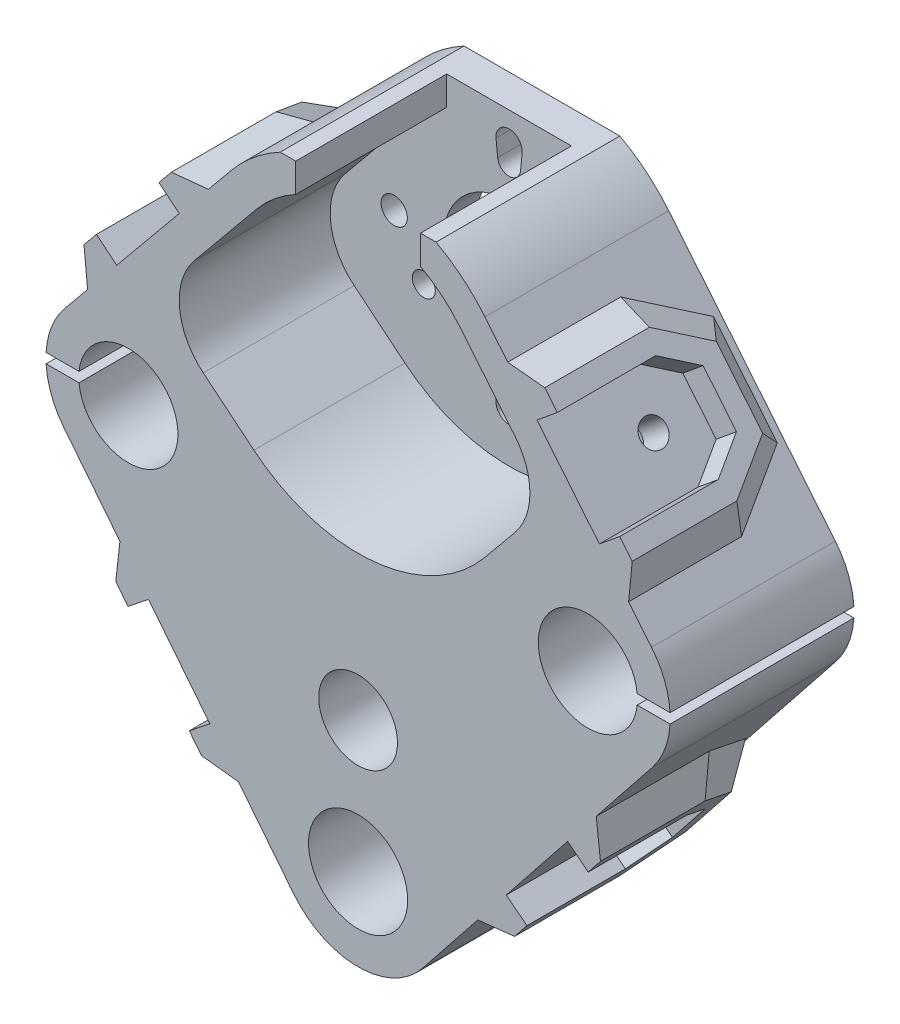
from build123d import *

# Parameters (mm, degrees)
SZKIC1_R                    = 7.550000000001571
SZKIC1_R_2                  = 6.000000000000003
DODANIE_WYCI_GNI_CIE1_DEPTH = 28
WYTNIJ_WYCI_GNI_CIE1_START  = -23
WYTNIJ_WYCI_GNI_CIE1_DEPTH  = 23
SZKIC3_R                    = 10.000000000000002
SZKIC3_R_2                  = 1.7500000000000033
SZKIC3_R_3                  = 1.7500000000000069
SZKIC3_R_4                  = 1.750000000000002
WYTNIJ_WYCI_GNI_CIE2_DEPTH  = 23
DODANIE_WYCI_GNI_CIE2_DEPTH = 23
ZAOKR_GLENIE2_R             = 10
WYTNIJ_WYCI_GNI_CIE3_START  = -10
SZKIC5_R                    = 2.000000000000005
SZKIC5_R_2                  = 2.0000000000000036
SZKIC5_R_3                  = 2.000000000000003
SZKIC5_R_4                  = 1.9999999999999971
SZKIC5_R_5                  = 1.7500000000000033
WYTNIJ_WYCI_GNI_CIE3_DEPTH  = 10
DODANIE_WYCI_GNI_CIE3_DEPTH = 4
SFAZOWANIE1_SIZE            = 4
DODANIE_WYCI_GNI_CIE4_DEPTH = 4
SFAZOWANIE2_SIZE            = 4
SZKIC8_R                    = 2.0000000000000018
WYTNIJ_WYCI_GNI_CIE4_DEPTH  = 5
SZKIC9_R                    = 1.9999999999999996
WYTNIJ_WYCI_GNI_CIE5_DEPTH  = 5
SFAZOWANIE3_SIZE            = 4


with BuildPart() as part:
    # Szkic1 → Dodanie-wyciągnięcie1 (new body)
    with BuildSketch(Plane.XY):
        with BuildLine():
            Line((-19.31958004687979, 62.866752245251845), (-44.69842918353365, 31.96510962711642))
            ThreePointArc((-44.69842918353365, 31.96510962711642), (-46.68388664689503, 28.581407297164034), (-47.527569596693525, 24.749999999999982))
            Line((-47.52756959669351, 24.74999999999998), (-42.512655988397164, 24.74999999999998))
            ThreePointArc((-42.51265598839718, 24.74999999999998), (-27.44999999999999, 24.000000000000014), (-42.51265598839717, 23.249999999999975))
            Line((-42.512655988397164, 23.24999999999998), (-47.52756959669352, 23.249999999999982))
            ThreePointArc((-47.52756959669352, 23.249999999999982), (-46.71930706256188, 19.509973054269363), (-44.82164322990438, 16.187329248939687))
            Line((-44.82164322990438, 16.18732924893969), (-9.82164322990438, -27.81267075106031))
            ThreePointArc((-9.82164322990438, -27.81267075106031), (8.21e-15, -32.55), (9.821643229904398, -27.81267075106031))
            Line((9.821643229904394, -27.812670751060306), (44.82164322990439, 16.187329248939694))
            ThreePointArc((44.82164322990438, 16.18732924893969), (46.71930706256188, 19.509973054269366), (47.52756959669352, 23.249999999999986))
            Line((47.52756959669352, 23.249999999999993), (42.512655988397164, 23.24999999999999))
            ThreePointArc((42.51265598839717, 23.249999999999986), (27.44999999999999, 24.00000000000001), (42.51265598839718, 24.74999999999999))
            Line((42.512655988397164, 24.74999999999999), (47.52756959669351, 24.74999999999999))
            ThreePointArc((47.52756959669352, 24.74999999999999), (46.68388664689503, 28.581407297164038), (44.69842918353365, 31.965109627116423))
            Line((44.698429183533655, 31.965109627116426), (19.319580046879793, 62.866752245251845))
            ThreePointArc((19.319580046879786, 62.866752245251845), (15.895577263173283, 66.29587063261175), (11.874342087037947, 68.99999999999999))
            Line((11.874342087037945, 68.99999999999999), (-11.874342087037945, 68.99999999999999))
            ThreePointArc((-11.87434208703795, 68.99999999999999), (-15.895577263173287, 66.29587063261175), (-19.31958004687979, 62.866752245251845))
        make_face()
        with Locations((-6.187e-14, -19.99999999999843)):
            Circle(SZKIC1_R, mode=Mode.SUBTRACT)
        Circle(SZKIC1_R_2, mode=Mode.SUBTRACT)
    extrude(amount=DODANIE_WYCI_GNI_CIE1_DEPTH)

    # Szkic2 → Wytnij-wyciągnięcie1 (cut)
    with BuildSketch(Plane.XY.offset(28).offset(WYTNIJ_WYCI_GNI_CIE1_START)):
        with BuildLine():
            Line((32.35059967573885, 47), (19.319580046879782, 62.866752245251845))
            ThreePointArc((19.319580046879782, 62.866752245251845), (15.89557726317328, 66.29587063261175), (11.874342087037947, 68.99999999999997))
            Line((11.874342087037945, 68.99999999999999), (-11.874342087037942, 68.99999999999999))
            ThreePointArc((-11.87434208703794, 68.99999999999999), (-15.895577263173282, 66.29587063261175), (-19.319580046879786, 62.86675224525184))
            Line((-19.31958004687979, 62.866752245251845), (-35.18633229213164, 43.54717219837204))
            Line((-35.18633229213164, 43.54717219837204), (-15.866752245251844, 27.680419953120204))
            ThreePointArc((-15.866752245251835, 27.680419953120207), (2.441517952800565, 22.11950583115053), (19.31958004687979, 31.13324775474816))
            Line((19.319580046879796, 31.133247754748155), (32.35059967573885, 47))
        make_face()
    extrude(amount=WYTNIJ_WYCI_GNI_CIE1_DEPTH, mode=Mode.SUBTRACT)

    # Szkic3 → Wytnij-wyciągnięcie2 (cut)
    with BuildSketch(Plane.XY.offset(5.000000000000001)):
        with Locations((0, 47)):
            Circle(SZKIC3_R)
        with Locations((0, 62)):
            Circle(SZKIC3_R_2)
        with Locations((12.990381056766878, 39.50000000000017)):
            Circle(SZKIC3_R_3)
        with Locations((-12.990381056766289, 39.49999999999982)):
            Circle(SZKIC3_R_4)
    extrude(amount=-WYTNIJ_WYCI_GNI_CIE2_DEPTH, mode=Mode.SUBTRACT)

    # Szkic4 → Dodanie-wyciągnięcie2 (add)
    with BuildSketch(Plane.XY.offset(5.000000000000001)):
        with BuildLine():
            Line((-9.499473669630353, 64.6), (-9.499473669630355, 69))
            Line((-9.499473669630355, 68.99999999999999), (-11.874342087037942, 68.99999999999999))
            ThreePointArc((-11.874342087037942, 68.99999999999999), (-15.895577263173275, 66.29587063261174), (-19.319580046879786, 62.866752245251845))
            Line((-19.31958004687979, 62.866752245251845), (-35.18633229213164, 43.54717219837204))
            Line((-35.18633229213164, 43.54717219837204), (-31.322416282755675, 40.37382174932167))
            Line((-31.322416282755682, 40.373821749321664), (-15.45566403750383, 59.69340179620147))
            ThreePointArc((-15.45566403750383, 59.69340179620147), (-12.716461810538625, 62.436696506089405), (-9.499473669630351, 64.6))
        make_face()
        with BuildLine():
            Line((29.115539708164945, 43.06094561546435), (32.350599675738835, 47))
            Line((32.350599675738835, 47), (19.319580046879796, 62.866752245251845))
            ThreePointArc((19.319580046879793, 62.866752245251845), (15.895577263173287, 66.29587063261175), (11.874342087037945, 68.99999999999999))
            Line((11.874342087037945, 68.99999999999999), (9.499473669630357, 68.99999999999999))
            Line((9.499473669630357, 69), (9.499473669630357, 64.6))
            ThreePointArc((9.499473669630355, 64.6), (12.716461810538629, 62.436696506089405), (15.455664037503837, 59.69340179620148))
            Line((15.455664037503837, 59.69340179620148), (28.48668366636287, 43.82664955094963))
            Line((28.48668366636287, 43.82664955094963), (29.115539708164945, 43.06094561546435))
        make_face()
    extrude(amount=DODANIE_WYCI_GNI_CIE2_DEPTH)

    # Zaokrąglenie2
    zaokr_glenie2_edges = [part.edges().sort_by_distance(p)[0] for p in [
        (-31.32241628275568, 40.373821749321664, 16.5),
        (29.115539708164945, 43.06094561546435, 16.5),
    ]]
    fillet(zaokr_glenie2_edges, radius=ZAOKR_GLENIE2_R)

    # Szkic5 → Wytnij-wyciągnięcie3 (cut)
    with BuildSketch(Plane(origin=(0, 0, 0), x_dir=(-1, 0, 0), z_dir=(0, 0, -1)).offset(WYTNIJ_WYCI_GNI_CIE3_START)):
        with Locations((-17.5, 47.00000000000005)):
            Circle(SZKIC5_R)
        with Locations((17.5, 46.99999999999994)):
            Circle(SZKIC5_R_2)
        with Locations((-4.684e-14, 29.5)):
            Circle(SZKIC5_R_3)
        with Locations((5.896e-14, 64.5)):
            Circle(SZKIC5_R_4)
        with Locations((0, 62)):
            Circle(SZKIC5_R_5)
        with BuildLine():
            ThreePointArc((-1.3905372163304106, 63.062500000000036), (-1.7999491829154104, 63.6281152949375), (-1.9899748742131833, 64.30000000000005))
            Line((-1.9899748742131869, 64.30000000000005), (-1.7412280149365922, 61.82500000000004))
            ThreePointArc((-1.7412280149365924, 61.82500000000004), (-1.683698289018324, 62.47713737178802), (-1.3905372163304301, 63.062500000000014))
        make_face()
        with BuildLine():
            ThreePointArc((1.7500000000000036, 62), (1.7478056279430847, 61.91239014364529), (1.7412280149365837, 61.82499999999995))
            Line((1.741228014936584, 61.82499999999995), (1.989974874213301, 64.30000000000005))
            ThreePointArc((1.9899748742133014, 64.30000000000005), (1.7999491829155065, 63.62811529493745), (1.3905372163304575, 63.062499999999964))
            ThreePointArc((1.3905372163304832, 63.06249999999994), (1.6577002335432005, 62.56082968511914), (1.7500000000000036, 62))
        make_face()
    extrude(amount=WYTNIJ_WYCI_GNI_CIE3_DEPTH, mode=Mode.SUBTRACT)

    # Szkic6 → Dodanie-wyciągnięcie3 (add)
    with BuildSketch(Plane(origin=(42.37131210135847, 34.798640021529614, 0), x_dir=(0, 0, -1), z_dir=(0.7727832018751915, 0.6346700898100739, 0))):
        Polygon((-28.000000000000004, 26.833343701652026), (-28.000000000000004, 23.833343701652026), (-13.000000000000002, 23.833343701652026), (-8, 20.333343701652034), (-8, 12.333343701652028), (-13.000000000000002, 8.83334370165203), (-28, 8.833343701652032), (-28, 5.83334370165203), (-12.0543333075427, 5.83334370165203), (-5, 10.771377016931917), (-5, 21.895310386372145), (-12.0543333075427, 26.833343701652026), align=None)
    dodanie_wyci_gni_cie3 = extrude(amount=DODANIE_WYCI_GNI_CIE3_DEPTH)

    # Sfazowanie1
    sfazowanie1_edges = [part.edges().sort_by_distance(p)[0] for p in [
        (25.3409914443264, 55.53499728430977, 20.027166653771353),
        (26.908002468173308, 53.62698268613559, 8.52716665377135),
        (32.00502738733217, 47.42077366462026, 5),
        (37.10205230649103, 41.21456464310493, 8.52716665377135),
        (38.66906333033795, 39.30655004493075, 20.02716665377135),
    ]]
    chamfer(sfazowanie1_edges, length=SFAZOWANIE1_SIZE - 0.0001)  # a hair under: the kernel refuses the full size

    # Szkic7 → Dodanie-wyciągnięcie4 (add)
    with BuildSketch(Plane(origin=(19.565395207126798, -15.563382551123588, 0), x_dir=(0, 0, -1), z_dir=(0.7826010541756485, -0.6225235658215388, 0))):
        Polygon((-28, 22.84797891648703), (-28, 19.84797891648703), (-13.000000000000002, 19.84797891648703), (-8, 16.34797891648703), (-8, 8.347978916487031), (-13.000000000000002, 4.8479789164870315), (-28, 4.847978916487031), (-28, 1.8479789164870304), (-12.0543333075427, 1.8479789164870304), (-5, 6.78601223176692), (-5, 17.909945601207145), (-12.054333307542692, 22.84797891648703), align=None)
    dodanie_wyci_gni_cie4 = extrude(amount=DODANIE_WYCI_GNI_CIE4_DEPTH)

    # Sfazowanie2
    sfazowanie2_edges = [part.edges().sort_by_distance(p)[0] for p in [
        (20.71580563178133, -14.117152302986465, 20.02716665377135),
        (22.252826685568124, -12.184897263940208, 8.52716665377135),
        (27.252303072907488, -5.899841234142155, 5),
        (32.251779460246844, 0.3852147956558962, 8.527166653771346),
        (33.78880051403364, 2.317469834702152, 20.027166653771346),
    ]]
    chamfer(sfazowanie2_edges, length=SFAZOWANIE2_SIZE - 0.0001)  # a hair under: the kernel refuses the full size

    # Szkic8 → Wytnij-wyciągnięcie4 (cut)
    with BuildSketch(Plane(origin=(42.37131210135847, 34.798640021529614, 0), x_dir=(0, 0, -1), z_dir=(0.7727832018751915, 0.6346700898100739, 0))):
        with Locations(Location((-15, 16.333343701652037, 0), (0, 0, 90))):
            Circle(SZKIC8_R)
    wytnij_wyci_gni_cie4 = extrude(amount=-WYTNIJ_WYCI_GNI_CIE4_DEPTH, mode=Mode.SUBTRACT)

    # Szkic9 → Wytnij-wyciągnięcie5 (cut)
    with BuildSketch(Plane(origin=(19.565395207126798, -15.563382551123588, 0), x_dir=(0, 0, -1), z_dir=(0.7826010541756485, -0.6225235658215388, 0))):
        with Locations(Location((-15, 12.347978916487023, 0), (0, 0, 90))):
            Circle(SZKIC9_R)
    wytnij_wyci_gni_cie5 = extrude(amount=-WYTNIJ_WYCI_GNI_CIE5_DEPTH, mode=Mode.SUBTRACT)

    # Lustro3: Dodanie-wyciągnięcie3, Dodanie-wyciągnięcie4, Wytnij-wyciągnięcie4, Wytnij-wyciągnięcie5 across plane
    add(dodanie_wyci_gni_cie3.mirror(Plane(origin=(0, 0, 0), x_dir=(0, 0, 1), z_dir=(1, 0, 0))))
    add(dodanie_wyci_gni_cie4.mirror(Plane(origin=(0, 0, 0), x_dir=(0, 0, 1), z_dir=(1, 0, 0))))
    add(wytnij_wyci_gni_cie4.mirror(Plane(origin=(0, 0, 0), x_dir=(0, 0, 1), z_dir=(1, 0, 0))), mode=Mode.SUBTRACT)
    add(wytnij_wyci_gni_cie5.mirror(Plane(origin=(0, 0, 0), x_dir=(0, 0, 1), z_dir=(1, 0, 0))), mode=Mode.SUBTRACT)

    # Sfazowanie3
    sfazowanie3_edges = [part.edges().sort_by_distance(p)[0] for p in [
        (-25.340991444326406, 55.534997284309775, 20.027166653771353),
        (-26.908002468173336, 53.6269826861356, 8.52716665377135),
        (-32.00502738733219, 47.42077366462027, 5),
        (-37.102052306491046, 41.214564643104936, 8.52716665377135),
        (-38.66906333033795, 39.30655004493076, 20.02716665377135),
        (-33.78880051403364, 2.317469834702152, 20.027166653771346),
        (-32.25177946024685, 0.3852147956558962, 8.527166653771346),
        (-27.25230307290748, -5.899841234142151, 5),
        (-22.252826685568124, -12.184897263940208, 8.527166653771351),
        (-20.71580563178133, -14.117152302986465, 20.02716665377135),
    ]]
    chamfer(sfazowanie3_edges, length=SFAZOWANIE3_SIZE - 0.0001)  # a hair under: the kernel refuses the full size


solid = part.part
